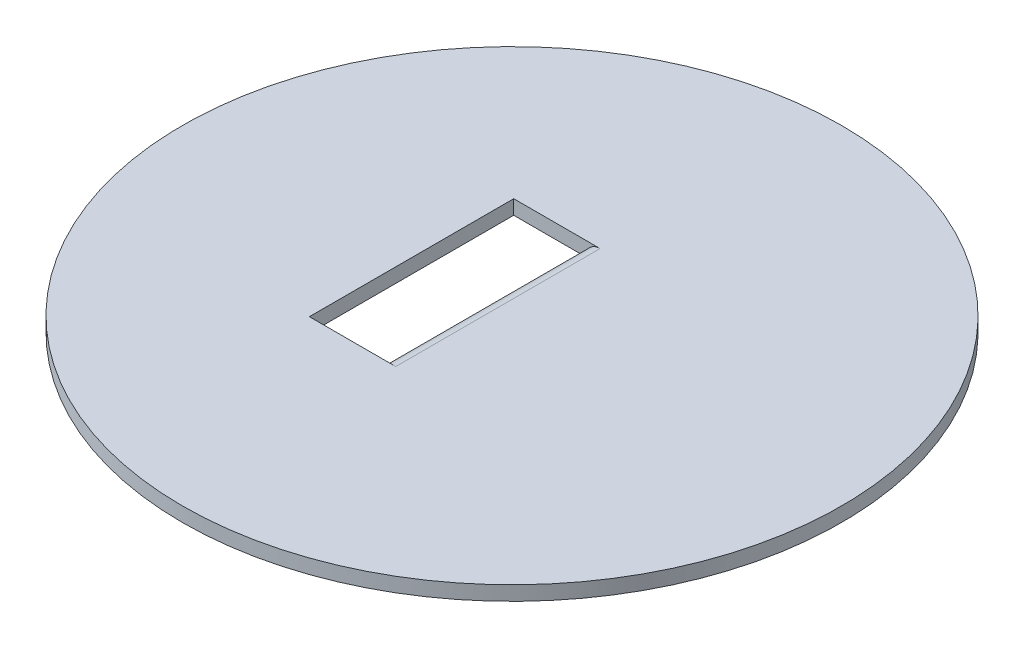
from build123d import *

# Parameters (mm, degrees)
BOSS_EXTRUDE1_DEPTH = 1
SKETCH2_R           = 1.9
SKETCH2_W           = 9.8
SKETCH2_H           = 29.28075205
BOSS_EXTRUDE2_DEPTH = 0.5
FILLET1_R           = 1
BOSS_EXTRUDE3_START = -1
BOSS_EXTRUDE3_DEPTH = 1


with BuildPart() as part:
    # Sketch1 → Boss-Extrude1 (new body)
    with BuildSketch(Plane(origin=(0, 0, 0), x_dir=(1, 0, 0), z_dir=(0, 1, 0))):
        with BuildLine():
            Line((-21.771541057, 7.1), (-1.980475175, 7.1))
            Line((-1.980475175, 7.1), (-1.980475175, -7.1))
            Line((-1.980475175, -7.1), (-21.771541057, -7.1))
            ThreePointArc((-21.771541057, -7.1), (22.9, 0), (-21.771541057, 7.1))
        make_face()
    extrude(amount=BOSS_EXTRUDE1_DEPTH)

    # Sketch2 → Boss-Extrude2 (add)
    with BuildSketch(Plane.XZ):
        with Locations(Location((-11.642490831, 11, 0), (0, 0, 90))):
            Circle(SKETCH2_R)
        with Locations(Location((-11.642490831, -11, 0), (0, 0, 90))):
            Circle(SKETCH2_R)
        with Locations((10, 0)):
            Rectangle(SKETCH2_W, SKETCH2_H)
    extrude(amount=BOSS_EXTRUDE2_DEPTH)

    # Fillet1
    fillet1_edges = [part.edges().sort_by_distance(p)[0] for p in [
        (-1.980475175, 1, 0),
    ]]
    fillet(fillet1_edges, radius=FILLET1_R - 0.0001)  # a hair under: the kernel refuses the full size

    # Sketch3 → Boss-Extrude3 (add)
    with BuildSketch(Plane(origin=(0, 1, 0), x_dir=(1, 0, 0), z_dir=(0, 1, 0)).offset(BOSS_EXTRUDE3_START)):
        with BuildLine():
            Line((-6.980475175, -7.1), (-21.771541057, -7.1))
            ThreePointArc((-21.771541057, -7.1), (-22.9, 0), (-21.771541057, 7.1))
            Line((-21.771541057, 7.1), (-6.980475175, 7.1))
            Line((-6.980475175, 7.1), (-6.980475175, -7.1))
        make_face()
    extrude(amount=BOSS_EXTRUDE3_DEPTH)


solid = part.part
